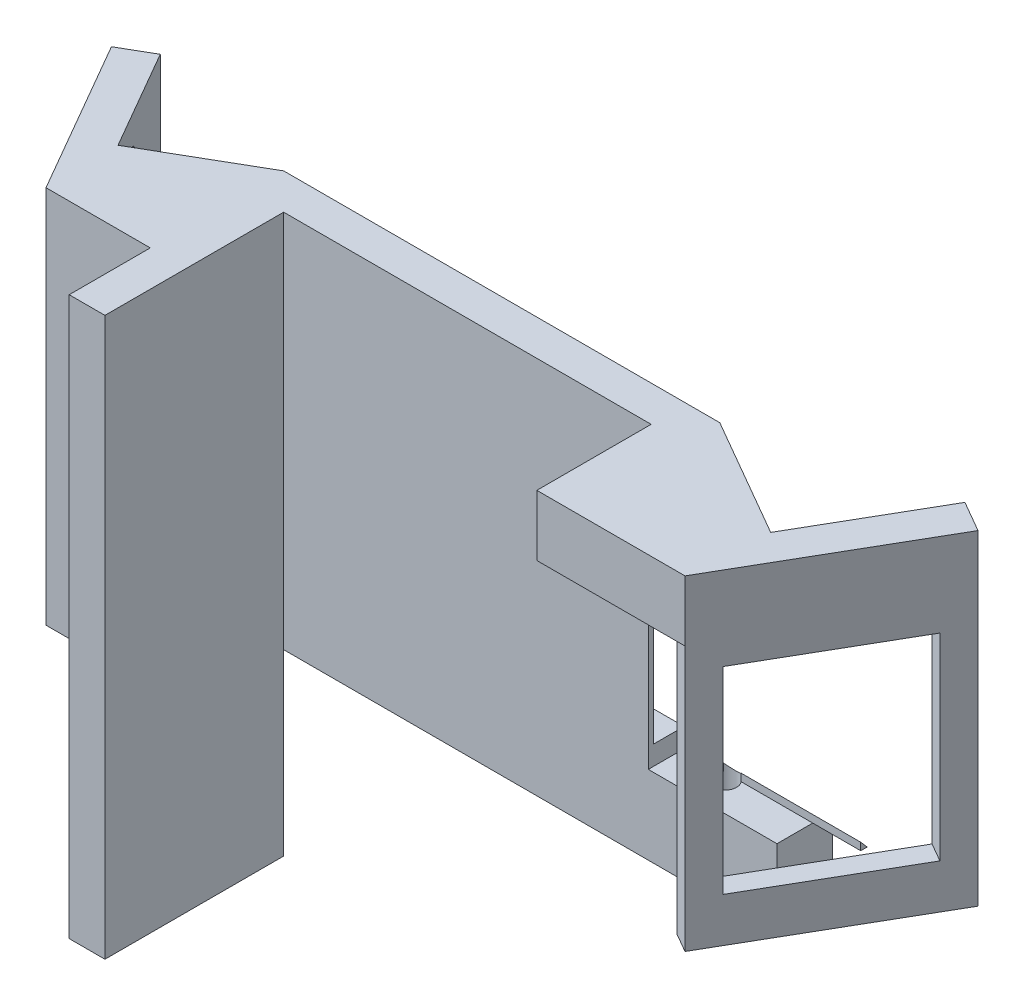
from build123d import *

# Parameters (mm, degrees)
SKETCH1_W                    = 56
SKETCH1_H                    = 5
BOSS_EXTRUDE1_DEPTH          = 42
SKETCH2_W                    = 5
SKETCH2_H                    = 25
BOSS_EXTRUDE2_DEPTH          = 78
BOSS_EXTRUDE3_DEPTH          = 5
SKETCH5_W                    = 30
SKETCH5_H                    = 37
BOSS_EXTRUDE4_DEPTH          = 3
SKETCH9_W                    = 80
SKETCH9_H                    = 10
BOSS_EXTRUDE7_DEPTH          = 7.8
SKETCH6_R                    = 1.7
CUT_EXTRUDE1_DEPTH           = 10
SKETCH6_3_R                  = 1.7
CUT_EXTRUDE2_DEPTH           = 7.8
BOSS_EXTRUDE5_REACH          = 114.771
CUT_EXTRUDE3_START           = 3
CUT_EXTRUDE3_DEPTH           = 30
BOSS_EXTRUDE8_REACH          = 104.503
SKETCH12_W                   = 6
SKETCH12_H                   = 10
SKETCH14_W                   = 21.376587736
SKETCH14_H                   = 30
BOSS_EXTRUDE9_DEPTH          = 10
CUT_EXTRUDE4_DEPTH           = 113.771445038
SKETCH17_W                   = 20
SKETCH17_H                   = 15
CUT_EXTRUDE5_DEPTH           = 94.029704558
CUT_EXTRUDE6_DEPTH           = 126.411384609
BOSS_EXTRUDE11_DEPTH         = 70
CUT_EXTRUDE7_DEPTH           = 94.029704558
CUT_EXTRUDE8_DEPTH           = 97.630216889
BOSS_EXTRUDE12_DEPTH         = 1
M3_START                     = -53
M3_CLEARANCE_HOLE1_OUTLINE_R = 1.6
M3_CLEARANCE_HOLE1_DEPTH     = 12.039780493
BOSS_EXTRUDE13_REACH         = 111.463
SKETCH25_W                   = 15
SKETCH25_H                   = 40.960219507
BOSS_EXTRUDE14_DEPTH         = 12.039780493
SKETCH27_W                   = 18
SKETCH27_H                   = 11.5
BOSS_EXTRUDE15_DEPTH         = 5.614909
SKETCH28_R                   = 3
CUT_EXTRUDE9_DEPTH           = 38
CHAMFER4_SIZE                = 2
BOSS_EXTRUDE16_DEPTH         = 8.5
CUT_EXTRUDE10_DEPTH          = 108.068430529
BOSS_EXTRUDE17_DEPTH         = 37
CUT_EXTRUDE11_DEPTH          = 40
CUT_EXTRUDE11_DEPTH_BACK     = 137.170264842
SKETCH31_W                   = 22.2
SKETCH31_H                   = 27.6


# Read off the part's stored shape, not the designer's step: M3 Clearance Hole1
with BuildPart() as part:
    # Sketch1 → Boss-Extrude1 (new body)
    with BuildSketch(Plane(origin=(0, 0, 0), x_dir=(1, 0, 0), z_dir=(0, 1, 0))):
        with Locations((-2.5, -25.75)):
            Rectangle(SKETCH1_W, SKETCH1_H)
    extrude(amount=-BOSS_EXTRUDE1_DEPTH)

    # Sketch2 → Boss-Extrude2 (add)
    with BuildSketch(Plane(origin=(0, 0, 0), x_dir=(1, 0, 0), z_dir=(0, 1, 0))):
        with Locations((-28, -40.75)):
            Rectangle(SKETCH2_W, SKETCH2_H)
    extrude(amount=-BOSS_EXTRUDE2_DEPTH)

    # Sketch9 → Boss-Extrude7 (add)
    with BuildSketch(Plane(origin=(0, 0, 28.25), x_dir=(-1, 0, 0), z_dir=(0, 0, -1))):
        with Locations((-3.5, -47)):
            Rectangle(SKETCH9_W, SKETCH9_H)
    extrude(amount=BOSS_EXTRUDE7_DEPTH)


with BuildPart() as body_2:
    # Sketch4 → Boss-Extrude3 (new body)
    with BuildSketch(Plane(origin=(-51.961524227, 0, 30), x_dir=(-0.500000000000001, 0, -0.8660254037844382), z_dir=(0.866025403784438, 0, -0.5000000000000009))):
        Polygon((1.25, -53), (8.25, -43.002963953), (8.25, -37), (11.25, -37), (11.25, 0), (-13.75, 0), (-13.75, -53), align=None)
    extrude(amount=BOSS_EXTRUDE3_DEPTH)

    # Sketch6 → Cut-Extrude1 (cut)
    with BuildSketch(Plane(origin=(-51.961524227, 0, 30), x_dir=(0.5000000000000009, 0, 0.8660254037844383), z_dir=(-0.8660254037844382, 0, 0.5000000000000008))):
        Polygon((10, -11.5), (-4.5, -11.5), (-10, -18.054644759), (-10, -32.945355241), (-4.5, -39.5), (10, -39.5), align=None)
        with Locations((0, -5.5)):
            Circle(SKETCH6_R)
    extrude(amount=-CUT_EXTRUDE1_DEPTH, mode=Mode.SUBTRACT)

    # Sketch6<3> → Cut-Extrude2 (cut)
    with BuildSketch(Plane(origin=(-51.961524227, 0, 30), x_dir=(0.5000000000000009, 0, 0.8660254037844383), z_dir=(-0.8660254037844382, 0, 0.5000000000000008))):
        with Locations((0, -45.5)):
            Circle(SKETCH6_3_R)
    extrude(amount=-CUT_EXTRUDE2_DEPTH, mode=Mode.SUBTRACT)

    # Boss-Extrude5: up to this face of the body (flat: up to its plane)
    boss_extrude5_end = Plane(body_2.part.faces().sort_by_distance((-46.671460718, -53, 34.162658774))[0])
    # Sketch7 → Boss-Extrude5 (add, up to the picked face)
    with BuildSketch(Plane(origin=(0, 0, 0), x_dir=(1, 0, 0), z_dir=(0, 1, 0)), mode=Mode.PRIVATE) as boss_extrude5_sk1:
        Polygon((-45.086524227, -41.907849302), (-30.5, -41.907849302), (-30.5, -36.160254038), (-42.631397208, -36.160254038), (-40.756397208, -39.407849302), align=None)
    boss_extrude5_tool1 = split(extrude(boss_extrude5_sk1.sketch, amount=-BOSS_EXTRUDE5_REACH, mode=Mode.PRIVATE), bisect_by=boss_extrude5_end, keep=Keep.BOTH, mode=Mode.PRIVATE)

    add(part.part)  # Boss-Extrude5 merges part
    add(boss_extrude5_tool1.solids().sort_by(Axis((-36.415744, 0, 39.11699), (0, -1, 0)))[0])

    # Sketch11 → Cut-Extrude3 (cut)
    with BuildSketch(Plane(origin=(-47.631397208, 0, 27.5), x_dir=(-0.5000000000000007, 0, -0.8660254037844384), z_dir=(0.8660254037844383, 0, -0.5000000000000006)).offset(CUT_EXTRUDE3_START)):
        Polygon((4.5, -42), (4.5, -39.5), (10, -32.945355241), (10, -18.054644759), (4.5, -11.5), (-10.5, -11.5), (-10.5, -42), align=None)
    extrude(amount=CUT_EXTRUDE3_DEPTH, mode=Mode.SUBTRACT)

    # Sketch12 → Boss-Extrude8 (add, up to next)
    with BuildSketch(Plane.XY.offset(28.25), mode=Mode.PRIVATE) as boss_extrude8_sk1:
        with Locations((-33.5, -47)):
            Rectangle(SKETCH12_W, SKETCH12_H)
    boss_extrude8_tool1 = extrude(boss_extrude8_sk1.sketch, amount=BOSS_EXTRUDE8_REACH, mode=Mode.PRIVATE) - body_2.part
    add(boss_extrude8_tool1.solids().sort_by_distance((-33.5, -47, 28.25))[0])

    # Sketch14 → Boss-Extrude9 (add)
    with BuildSketch(Plane(origin=(12.865054877, -25.730109754, 22.282928689), x_dir=(0.8660254037844385, 0, -0.5000000000000004), z_dir=(0.3535533905932723, -0.7071067811865512, 0.6123724356957913))):
        with Locations((-39.001760389, -22.151235068)):
            Rectangle(SKETCH14_W, SKETCH14_H)
    extrude(amount=BOSS_EXTRUDE9_DEPTH)

    # Sketch15 → Cut-Extrude4 (cut, through all)
    with BuildSketch(Plane(origin=(0, 0, 0), x_dir=(1, 0, 0), z_dir=(0, 1, 0))):
        Polygon((-36.5, -36.160254038), (-36.5, -20.45), (-43.302739548, -24.377563509), align=None)
        Polygon((-36.5, -20.45), (-20.88676203, -20.45), (-24.790071522, -13.689269641), align=None)
        Polygon((-16.38342993, -28.25), (-25.5, -28.25), (-25.5, -46.759010276), (-10.647935899, -38.184167069), align=None)
        Polygon((-30.5, -41.907849302), (-33.181624327, -41.907849302), (-30.5, -46.552558883), align=None)
    extrude(amount=-CUT_EXTRUDE4_DEPTH, mode=Mode.SUBTRACT)

    # Sketch17 → Cut-Extrude5 (cut, through all)
    with BuildSketch(Plane(origin=(12.865054877, -25.730109754, 22.282928689), x_dir=(0.8660254037844385, 0, -0.5000000000000004), z_dir=(0.3535533905932723, -0.7071067811865512, 0.6123724356957913))):
        with Locations((-38.313466521, -30.509099445)):
            Rectangle(SKETCH17_W, SKETCH17_H)
    extrude(amount=-CUT_EXTRUDE5_DEPTH, mode=Mode.SUBTRACT)

    # Sketch18 → Cut-Extrude6 (cut, through all)
    with BuildSketch(Plane.ZY.offset(20.88676203)):
        Polygon((20.45, -42), (22.349523679, -42), (20.45, -44.193381015), align=None)
    extrude(amount=-CUT_EXTRUDE6_DEPTH, mode=Mode.SUBTRACT)

    # Sketch20 → Boss-Extrude11 (add)
    with BuildSketch(Plane.ZY.offset(19.790071522)):
        Polygon((23.25, -40.960219507), (22.349523679, -42), (23.25, -42), align=None)
    extrude(amount=-BOSS_EXTRUDE11_DEPTH)

    # Sketch21 → Cut-Extrude7 (cut, through all)
    with BuildSketch(Plane(origin=(12.865054877, -25.730109754, 22.282928689), x_dir=(0.935414346693486, 0.2672612419124244, -0.23145502494313555), z_dir=(-0.35355339059327223, 0.7071067811865507, -0.6123724356957918))):
        Polygon((-34.354012493, 9.239410059), (-34.909798545, 10.600802291), (-37.243131878, 10.600802291), (-36.354012493, 8.422913478), align=None)
    extrude(amount=CUT_EXTRUDE7_DEPTH, mode=Mode.SUBTRACT)

    # Sketch22 → Cut-Extrude8 (cut, through all)
    with BuildSketch(Plane.XZ.offset(52)):
        Polygon((-30.5, 28.25), (-30.5, 36.160254038), (-36.565698604, 36.160254038), (-36.5, 20.45), (-16.5, 20.45), (-16.5, 28.25), align=None)
    extrude(amount=CUT_EXTRUDE8_DEPTH, mode=Mode.SUBTRACT)

    # Sketch24 → Boss-Extrude12 (add)
    with BuildSketch(Plane.XZ.offset(52)):
        Polygon((-30.5, 36.160254038), (-36.5, 36.160254038), (-36.5, 20.45), (43.5, 20.45), (43.5, 28.25), (-25.5, 28.25), (-30.5, 28.25), align=None)
    extrude(amount=BOSS_EXTRUDE12_DEPTH)

    # M3 Clearance Hole1 outline → M3 Clearance Hole1 (cut)
    with BuildSketch(Plane(origin=(0, 0, 0), x_dir=(1, 0, 0), z_dir=(0, 1, 0)).offset(M3_START)):
        with Locations((-32.25, -24.25)):
            Circle(M3_CLEARANCE_HOLE1_OUTLINE_R)
        with Locations((32.25, -24.25)):
            Circle(M3_CLEARANCE_HOLE1_OUTLINE_R)
    extrude(amount=M3_CLEARANCE_HOLE1_DEPTH, mode=Mode.SUBTRACT)

    # Boss-Extrude13: up to this face of the body (flat: up to its plane)
    boss_extrude13_end = Plane(body_2.part.faces().sort_by_distance((-37.124420642, -23.2412407, 36.160254038))[0])
    # Sketch25 → Boss-Extrude13 (add, up to the picked face)
    with BuildSketch(Plane(origin=(5.25, 0, 9.09326674), x_dir=(-0.8660254037844383, 0, 0.5000000000000008), z_dir=(-0.5000000000000007, 0, -0.8660254037844382)), mode=Mode.PRIVATE) as boss_extrude13_sk1:
        with Locations((48.780544247, -20.480109754)):
            Rectangle(SKETCH25_W, SKETCH25_H)
    boss_extrude13_tool1 = split(extrude(boss_extrude13_sk1.sketch, amount=-BOSS_EXTRUDE13_REACH, mode=Mode.PRIVATE), bisect_by=boss_extrude13_end, keep=Keep.BOTH, mode=Mode.PRIVATE)
    add(boss_extrude13_tool1.solids().sort_by(Axis((-36.995191, -20.48011, 33.483539), (0.5000000000000007, 0, 0.8660254037844382)))[0])

    # Sketch26 → Boss-Extrude14 (add)
    with BuildSketch(Plane.XZ.offset(40.960219507)):
        Polygon((-36.5, 33.197640478), (-36.5, 36.160254038), (-41.631397208, 36.160254038), align=None)
    extrude(amount=BOSS_EXTRUDE14_DEPTH)

    # Sketch27 → Boss-Extrude15 (add)
    with BuildSketch(Plane(origin=(5.25, 0, 9.09326674), x_dir=(-0.8660254037844383, 0, 0.5000000000000008), z_dir=(-0.5000000000000007, 0, -0.8660254037844382))):
        with Locations((47.038774815, -5.75)):
            Rectangle(SKETCH27_W, SKETCH27_H)
    extrude(amount=BOSS_EXTRUDE15_DEPTH)

    # Sketch28 → Cut-Extrude9 (cut)
    with BuildSketch(Plane.XZ.offset(11.5)):
        with Locations((-32.25, 24.25)):
            Circle(SKETCH28_R)
    extrude(amount=CUT_EXTRUDE9_DEPTH, mode=Mode.SUBTRACT)

    # Chamfer4
    chamfer4_edges = [body_2.edges().sort_by_distance(p)[0] for p in [
        (3.5, -53, 20.45),
    ]]
    chamfer(chamfer4_edges, length=CHAMFER4_SIZE)

    # Sketch29 → Boss-Extrude16 (add)
    with BuildSketch(Plane(origin=(0, 0, 0), x_dir=(1, 0, 0), z_dir=(0, 1, 0))):
        Polygon((25.5, -23.25), (30.5, -23.25), (47.353915399, -32.980612592), (57.296460718, -15.759618943), (61.626587737, -18.259618943), (46.626587737, -44.240381057), (25.9, -44.240381057), (25.9, -28.25), (25.5, -28.25), align=None)
    extrude(amount=-BOSS_EXTRUDE16_DEPTH)

    # Sketch30<2> → Boss-Extrude17 (add)
    with BuildSketch(Plane.XZ.offset(8.5)):
        Polygon((46.626587737, 44.240381057), (44.028511525, 42.740381057), (59.028511525, 16.759618943), (61.626587737, 18.259618943), align=None)
    extrude(amount=BOSS_EXTRUDE17_DEPTH)

    # Sketch31 → Cut-Extrude11 (cut, two sides: drawn at the far end of the back side and taken through both)
    with BuildSketch(Plane(origin=(51.528511525, 0, 29.75), x_dir=(-0.5000000000000012, 0, 0.866025403784438), z_dir=(-0.8660254037844379, 0, -0.5000000000000011)).offset(-CUT_EXTRUDE11_DEPTH_BACK)):
        with Locations((0, -25.5)):
            Rectangle(SKETCH31_W, SKETCH31_H)
    extrude(amount=CUT_EXTRUDE11_DEPTH + CUT_EXTRUDE11_DEPTH_BACK, mode=Mode.SUBTRACT)


with BuildPart() as body_3:
    # Sketch5 → Boss-Extrude4 (new body)
    with BuildSketch(Plane(origin=(54.126587737, 0, 31.25), x_dir=(0.5000000000000011, 0, -0.866025403784438), z_dir=(0.866025403784438, 0, 0.5000000000000011))):
        with Locations((0, -27)):
            Rectangle(SKETCH5_W, SKETCH5_H)
    extrude(amount=-BOSS_EXTRUDE4_DEPTH)

    # Sketch30 → Cut-Extrude10 (cut, through all)
    with BuildSketch(Plane.XZ.offset(8.5)):
        Polygon((46.626587737, 44.240381057), (44.028511525, 42.740381057), (59.028511525, 16.759618943), (61.626587737, 18.259618943), align=None)
    extrude(amount=CUT_EXTRUDE10_DEPTH, mode=Mode.SUBTRACT)


solid = body_2.part
